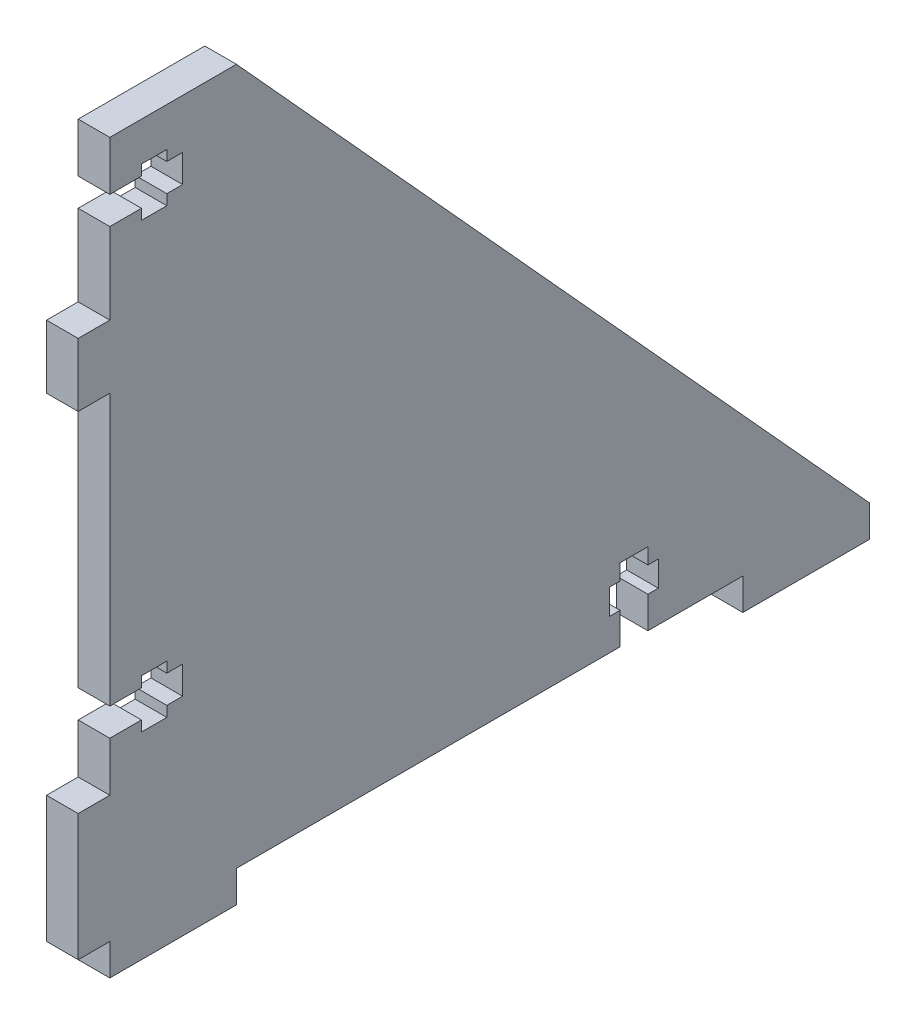
from build123d import *

# Parameters (mm, degrees)
BOSS_EXTRUDE1_DEPTH = 5


with BuildPart() as part:
    # Sketch1 → Boss-Extrude1 (new body)
    with BuildSketch(Plane(origin=(0, 0, 0), x_dir=(0, 0, -1), z_dir=(1, 0, 0))):
        Polygon((120, 0), (20, 110), (0, 110), (0, 102.2), (5, 102.2), (5, 103.85), (9, 103.85), (9, 102.2), (11.5, 102.2), (11.5, 97.8), (9, 97.8), (9, 96.15), (5, 96.15), (5, 97.8), (0, 97.8), (0, 85), (-5, 85), (-5, 75), (0, 75), (0, 32.2), (5, 32.2), (5, 33.85), (9, 33.85), (9, 32.2), (11.5, 32.2), (11.5, 27.8), (9, 27.8), (9, 26.15), (5, 26.15), (5, 27.8), (0, 27.8), (0, 20), (-5, 20), (-5, 0), (0, 0), (0, -5), (20, -5), (20, 0), (80.6, 0), (80.6, 5), (78.95, 5), (78.95, 9), (80.6, 9), (80.6, 11.5), (85, 11.5), (85, 9), (86.65, 9), (86.65, 5), (85, 5), (85, 0), (100, 0), (100, -5), (120, -5), align=None)
    extrude(amount=BOSS_EXTRUDE1_DEPTH)


solid = part.part
